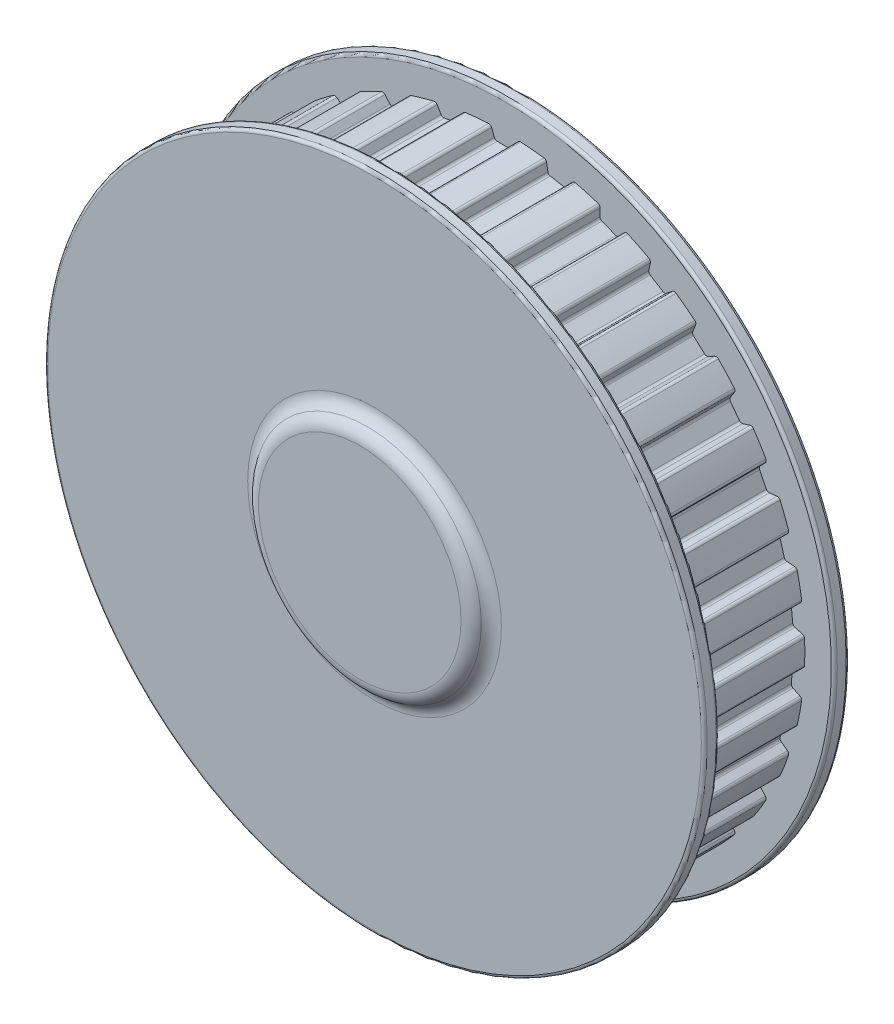
from build123d import *

# Parameters (mm, degrees)
BOSS_EXTRUDE1_DEPTH      = 7.25
BOSS_EXTRUDE1_DEPTH_BACK = 7.25
SKETCH7_R                = 50.756168406
CUT_EXTRUDE3_DEPTH       = 75.002549027
CUT_EXTRUDE3_DEPTH_BACK  = 75.002549027
SKETCH15_R               = 8.008120878
SKETCH15_R_2             = 2.25
BOSS_EXTRUDE2_DEPTH      = 5.5
SKETCH16_R               = 5
CUT_EXTRUDE4_DEPTH       = 3
BOSS_EXTRUDE3_START      = 7.5
SKETCH17_R               = 50.756168406
SKETCH17_R_2             = 5
BOSS_EXTRUDE3_DEPTH      = 7.5
CUT_EXTRUDE2_DEPTH       = 75.002549027
CUT_EXTRUDE2_DEPTH_BACK  = 75.002549027
FILLET2_R                = 0.51
BOSS_EXTRUDE4_START      = 2.5
SKETCH18_R               = 55.756168406
SKETCH18_R_2             = 50.756168406
SKETCH18_R_3             = 5
BOSS_EXTRUDE4_DEPTH      = 2.5
BOSS_EXTRUDE5_START      = -2.5
SKETCH19_R               = 55.756168406
SKETCH19_R_2             = 19
BOSS_EXTRUDE5_DEPTH      = 2.5
CUT_EXTRUDE5_DEPTH       = 87.371656987
FILLET3_R                = 0.5
CUT_EXTRUDE6_DEPTH       = 81.879543979
CUT_EXTRUDE6_DEPTH_BACK  = 81.879543979
SKETCH21_R               = 12.5
SKETCH22_R               = 18.951921224
CUT_EXTRUDE7_DEPTH       = 83.569671373
SKETCH22_2_R             = 18.951921224
BOSS_EXTRUDE6_DEPTH      = 2.5
FILLET4_R                = 2.5
FILLET5_R                = 2.5


with BuildPart() as part:
    # Sketch7 → Boss-Extrude1 (new, two sides: drawn at the far end of the back side and taken through both)
    with BuildSketch(Plane.XY.offset(-BOSS_EXTRUDE1_DEPTH_BACK)):
        Circle(SKETCH7_R)
    extrude(amount=BOSS_EXTRUDE1_DEPTH + BOSS_EXTRUDE1_DEPTH_BACK)

    # Sketch14 → Revolve1 (revolve)
    with BuildSketch(Plane(origin=(0, 0, 0), x_dir=(0, 0, -1), z_dir=(1, 0, 0)), mode=Mode.PRIVATE) as revolve1_sk:
        Polygon((-18, 6.739517467), (-18, 0), (0, 0), (0, 19), (-3.355534752, 19), (-11.020158508, 12.583105693), align=None)
        with BuildLine():
            ThreePointArc((-7.25, 19), (-8.580081567, 15.465471544), (-11.020158508, 12.583105693))
            Line((-11.020158508, 12.583105693), (-3.355534752, 19))
            Line((-3.355534752, 19), (-7.25, 19))
        make_face()
        with BuildLine():
            Line((-18, 10), (-18, 6.739517467))
            Line((-18, 6.739517467), (-11.020158508, 12.583105693))
            ThreePointArc((-11.020158508, 12.583105693), (-14.286666254, 10.687865845), (-18, 10))
        make_face()
    revolve(revolve1_sk.sketch.rotate(Axis((0, 0, -36.129595921), (0, 0, 1)), 270), axis=Axis((0, 0, -36.129595921), (0, 0, 1)))

    # Sketch10 → Cut-Extrude3 (cut, two sides: drawn at the far end of the back side and taken through both)
    with BuildSketch(Plane.XY.offset(-CUT_EXTRUDE3_DEPTH_BACK)):
        with BuildLine():
            Line((2.2, 7.7), (-2.2, 7.7))
            Line((-2.2, 7.7), (-2.2, 5.796550698))
            ThreePointArc((-2.2, 5.796550698), (0, 6.2), (2.2, 5.796550698))
            Line((2.2, 5.796550698), (2.2, 7.7))
        make_face()
        with BuildLine():
            ThreePointArc((2.2, 5.796550698), (0, 6.2), (-2.2, 5.796550698))
            Line((-2.2, 5.796550698), (-2.2, 0))
            Line((-2.2, 0), (2.2, 0))
            Line((2.2, 0), (2.2, 5.796550698))
        make_face()
        with BuildLine():
            Line((-2.2, 0), (-2.2, 5.796550698))
            ThreePointArc((-2.2, 5.796550698), (-3.521363372, -5.102940329), (6.2, 0))
            ThreePointArc((6.2, 0), (5.102940329, 3.521363372), (2.2, 5.796550698))
            Line((2.2, 5.796550698), (2.2, 0))
            Line((2.2, 0), (-2.2, 0))
        make_face()
    extrude(amount=CUT_EXTRUDE3_DEPTH + CUT_EXTRUDE3_DEPTH_BACK, mode=Mode.SUBTRACT)

    # Sketch15 → Boss-Extrude2 (add)
    with BuildSketch(Plane(origin=(0, 0, -7.25), x_dir=(-1, 0, 0), z_dir=(0, 0, -1))):
        Circle(SKETCH15_R)
        Circle(SKETCH15_R_2, mode=Mode.SUBTRACT)
    extrude(amount=-BOSS_EXTRUDE2_DEPTH)

    # Sketch16 → Cut-Extrude4 (cut)
    with BuildSketch(Plane(origin=(0, 0, -7.25), x_dir=(-1, 0, 0), z_dir=(0, 0, -1))):
        Circle(SKETCH16_R)
    extrude(amount=-CUT_EXTRUDE4_DEPTH, mode=Mode.SUBTRACT)

    # Sketch17 → Boss-Extrude3 (add)
    with BuildSketch(Plane(origin=(0, 0, -7.25), x_dir=(-1, 0, 0), z_dir=(0, 0, -1)).offset(BOSS_EXTRUDE3_START)):
        with Locations(Location((0, 0, 0), (0, 0, 180))):
            Circle(SKETCH17_R)
        Circle(SKETCH17_R_2, mode=Mode.SUBTRACT)
    extrude(amount=-BOSS_EXTRUDE3_DEPTH)

    # Sketch8 → Cut-Extrude2 (cut, two sides: drawn at the far end of the back side and taken through both)
    with BuildSketch(Plane.XY.offset(-CUT_EXTRUDE2_DEPTH_BACK)):
        Polygon((-1.629816853, 48.792889526), (-2.344391927, 50.756168406), (2.344391927, 50.756168406), (1.629816853, 48.792889526), align=None)
        Polygon((7.3636038, 48.261575921), (7.021947272, 50.322729072), (11.63089567, 49.4611673), (10.567736047, 47.662619799), align=None)
        Polygon((16.106265756, 46.086772231), (16.149162478, 48.175609555), (20.521323211, 46.481825464), (19.145783664, 44.90925672), align=None)
        Polygon((24.30044815, 42.342538787), (24.726437325, 44.387927435), (28.712921702, 41.91960081), (27.071844582, 40.626562766), align=None)
        Polygon((31.667107927, 37.15638097), (32.461683004, 39.088667684), (35.926736083, 35.929854428), (34.076006302, 34.960379943), align=None)
        Polygon((37.955382324, 30.704907163), (39.091485003, 32.458290236), (41.917108555, 28.716559947), (39.919750497, 28.103663312), align=None)
        Polygon((42.951131699, 23.207814569), (44.390073364, 24.722584644), (46.48004417, 20.525357458), (44.404075467, 20.289910133), align=None)
        Polygon((46.484231797, 14.920407684), (48.177011018, 16.144981083), (49.460157627, 11.635188538), (47.376272904, 11.785208399), align=None)
        Polygon((48.434367134, 6.124904211), (50.323338343, 7.017579555), (50.755964737, 2.348797228), (48.735128188, 2.879175529), align=None)
        Polygon((48.735128188, -2.879175529), (50.755964737, -2.348797228), (50.323338343, -7.017579555), (48.434367134, -6.124904211), align=None)
        Polygon((47.376272904, -11.785208399), (49.460157627, -11.635188538), (48.177011018, -16.144981083), (46.484231797, -14.920407684), align=None)
        Polygon((44.404075467, -20.289910133), (46.48004417, -20.525357458), (44.390073364, -24.722584644), (42.951131699, -23.207814569), align=None)
        Polygon((39.919750497, -28.103663312), (41.917108555, -28.716559947), (39.091485003, -32.458290236), (37.955382324, -30.704907163), align=None)
        Polygon((34.076006302, -34.960379943), (35.926736083, -35.929854428), (32.461683004, -39.088667684), (31.667107927, -37.15638097), align=None)
        Polygon((27.071844582, -40.626562766), (28.712921702, -41.91960081), (24.726437325, -44.387927435), (24.30044815, -42.342538787), align=None)
        Polygon((19.145783664, -44.90925672), (20.521323211, -46.481825464), (16.149162478, -48.175609555), (16.106265756, -46.086772231), align=None)
        Polygon((10.567736047, -47.662619799), (11.63089567, -49.4611673), (7.021947272, -50.322729072), (7.3636038, -48.261575921), align=None)
        Polygon((1.629816853, -48.792889526), (2.344391927, -50.756168406), (-2.344391927, -50.756168406), (-1.629816853, -48.792889526), align=None)
        Polygon((-7.3636038, -48.261575921), (-7.021947272, -50.322729072), (-11.63089567, -49.4611673), (-10.567736047, -47.662619799), align=None)
        Polygon((-16.106265756, -46.086772231), (-16.149162478, -48.175609555), (-20.521323211, -46.481825464), (-19.145783664, -44.90925672), align=None)
        Polygon((-24.30044815, -42.342538787), (-24.726437325, -44.387927435), (-28.712921702, -41.91960081), (-27.071844582, -40.626562766), align=None)
        Polygon((-31.667107927, -37.15638097), (-32.461683004, -39.088667684), (-35.926736083, -35.929854428), (-34.076006302, -34.960379943), align=None)
        Polygon((-37.955382324, -30.704907163), (-39.091485003, -32.458290236), (-41.917108555, -28.716559947), (-39.919750497, -28.103663312), align=None)
        Polygon((-42.951131699, -23.207814569), (-44.390073364, -24.722584644), (-46.48004417, -20.525357458), (-44.404075467, -20.289910133), align=None)
        Polygon((-46.484231797, -14.920407684), (-48.177011018, -16.144981083), (-49.460157627, -11.635188538), (-47.376272904, -11.785208399), align=None)
        Polygon((-48.434367134, -6.124904211), (-50.323338343, -7.017579555), (-50.755964737, -2.348797228), (-48.735128188, -2.879175529), align=None)
        Polygon((-48.735128188, 2.879175529), (-50.755964737, 2.348797228), (-50.323338343, 7.017579555), (-48.434367134, 6.124904211), align=None)
        Polygon((-47.376272904, 11.785208399), (-49.460157627, 11.635188538), (-48.177011018, 16.144981083), (-46.484231797, 14.920407684), align=None)
        Polygon((-44.404075467, 20.289910133), (-46.48004417, 20.525357458), (-44.390073364, 24.722584644), (-42.951131699, 23.207814569), align=None)
        Polygon((-39.919750497, 28.103663312), (-41.917108555, 28.716559947), (-39.091485003, 32.458290236), (-37.955382324, 30.704907163), align=None)
        Polygon((-34.076006302, 34.960379943), (-35.926736083, 35.929854428), (-32.461683004, 39.088667684), (-31.667107927, 37.15638097), align=None)
        Polygon((-27.071844582, 40.626562766), (-28.712921702, 41.91960081), (-24.726437325, 44.387927435), (-24.30044815, 42.342538787), align=None)
        Polygon((-19.145783664, 44.90925672), (-20.521323211, 46.481825464), (-16.149162478, 48.175609555), (-16.106265756, 46.086772231), align=None)
        Polygon((-10.567736047, 47.662619799), (-11.63089567, 49.4611673), (-7.021947272, 50.322729072), (-7.3636038, 48.261575921), align=None)
    extrude(amount=CUT_EXTRUDE2_DEPTH + CUT_EXTRUDE2_DEPTH_BACK, mode=Mode.SUBTRACT)

    # Fillet2
    fillet2_edges = [part.edges().sort_by_distance(p)[0] for p in [
        (28.668386638, -41.884510727, -3.75),
        (24.714876957, -44.332420285, -3.75),
        (24.30044815, -42.342538787, -3.75),
        (27.071844582, -40.626562766, -3.75),
        (35.876511526, -35.903545117, -3.75),
        (32.440120061, -39.03622986, -3.75),
        (31.667107927, -37.15638097, -3.75),
        (34.076006302, -34.960379943, -3.75),
        (41.862904844, -28.699927339, -3.75),
        (39.060653785, -32.410707446, -3.75),
        (37.955382324, -30.704907163, -3.75),
        (39.919750497, -28.103663312, -3.75),
        (46.423707146, -20.518967958, -3.75),
        (44.351023792, -24.681477263, -3.75),
        (42.951131699, -23.207814569, -3.75),
        (44.404075467, -20.289910133, -3.75),
        (49.403605781, -11.639259733, -3.75),
        (48.131072877, -16.111748973, -3.75),
        (46.484231797, -14.920407684, -3.75),
        (47.376272904, -11.785208399, -3.75),
        (50.701123874, -2.363190477, -3.75),
        (50.272076002, -6.993354396, -3.75),
        (48.434367134, -6.124904211, -3.75),
        (48.735128188, -2.879175529, -3.75),
        (50.272076002, 6.993354396, -3.75),
        (50.701123874, 2.363190477, -3.75),
        (48.735128188, 2.879175529, -3.75),
        (48.434367134, 6.124904211, -3.75),
        (48.131072877, 16.111748973, -3.75),
        (49.403605781, 11.639259733, -3.75),
        (47.376272904, 11.785208399, -3.75),
        (46.484231797, 14.920407684, -3.75),
        (44.351023792, 24.681477263, -3.75),
        (46.423707146, 20.518967958, -3.75),
        (44.404075467, 20.289910133, -3.75),
        (42.951131699, 23.207814569, -3.75),
        (39.060653785, 32.410707446, -3.75),
        (41.862904844, 28.699927339, -3.75),
        (39.919750497, 28.103663312, -3.75),
        (37.955382324, 30.704907163, -3.75),
        (32.440120061, 39.03622986, -3.75),
        (35.876511526, 35.903545117, -3.75),
        (34.076006302, 34.960379943, -3.75),
        (31.667107927, 37.15638097, -3.75),
        (24.714876957, 44.332420285, -3.75),
        (28.668386638, 41.884510727, -3.75),
        (27.071844582, 40.626562766, -3.75),
        (24.30044815, 42.342538787, -3.75),
        (16.147998359, 48.118923307, -3.75),
        (20.483994226, 46.43914956, -3.75),
        (19.145783664, 44.90925672, -3.75),
        (16.106265756, 46.086772231, -3.75),
        (7.031219046, 50.266794109, -3.75),
        (11.602043959, 49.412358851, -3.75),
        (10.567736047, 47.662619799, -3.75),
        (7.3636038, 48.261575921, -3.75),
        (11.602043959, -49.412358851, -3.75),
        (7.031219046, -50.266794109, -3.75),
        (7.3636038, -48.261575921, -3.75),
        (10.567736047, -47.662619799, -3.75),
        (20.483994226, -46.43914956, -3.75),
        (16.147998359, -48.118923307, -3.75),
        (16.106265756, -46.086772231, -3.75),
        (19.145783664, -44.90925672, -3.75),
        (2.325, -50.702889526, -3.75),
        (-2.325, -50.702889526, -3.75),
        (-1.629816853, -48.792889526, -3.75),
        (1.629816853, -48.792889526, -3.75),
        (-7.031219046, -50.266794109, -3.75),
        (-11.602043959, -49.412358851, -3.75),
        (-10.567736047, -47.662619799, -3.75),
        (-7.3636038, -48.261575921, -3.75),
        (-16.147998359, -48.118923307, -3.75),
        (-20.483994226, -46.43914956, -3.75),
        (-19.145783664, -44.90925672, -3.75),
        (-16.106265756, -46.086772231, -3.75),
        (-24.714876957, -44.332420285, -3.75),
        (-28.668386638, -41.884510727, -3.75),
        (-27.071844582, -40.626562766, -3.75),
        (-24.30044815, -42.342538787, -3.75),
        (-32.440120061, -39.03622986, -3.75),
        (-35.876511526, -35.903545117, -3.75),
        (-34.076006302, -34.960379943, -3.75),
        (-31.667107927, -37.15638097, -3.75),
        (-39.060653785, -32.410707446, -3.75),
        (-41.862904844, -28.699927339, -3.75),
        (-39.919750497, -28.103663312, -3.75),
        (-37.955382324, -30.704907163, -3.75),
        (-44.351023792, -24.681477263, -3.75),
        (-46.423707146, -20.518967958, -3.75),
        (-44.404075467, -20.289910133, -3.75),
        (-42.951131699, -23.207814569, -3.75),
        (-48.131072877, -16.111748973, -3.75),
        (-49.403605781, -11.639259733, -3.75),
        (-47.376272904, -11.785208399, -3.75),
        (-46.484231797, -14.920407684, -3.75),
        (-50.272076002, -6.993354396, -3.75),
        (-50.701123874, -2.363190477, -3.75),
        (-48.735128188, -2.879175529, -3.75),
        (-48.434367134, -6.124904211, -3.75),
        (-50.701123874, 2.363190477, -3.75),
        (-50.272076002, 6.993354396, -3.75),
        (-48.434367134, 6.124904211, -3.75),
        (-48.735128188, 2.879175529, -3.75),
        (-49.403605781, 11.639259733, -3.75),
        (-48.131072877, 16.111748973, -3.75),
        (-46.484231797, 14.920407684, -3.75),
        (-47.376272904, 11.785208399, -3.75),
        (-46.423707146, 20.518967958, -3.75),
        (-44.351023792, 24.681477263, -3.75),
        (-42.951131699, 23.207814569, -3.75),
        (-44.404075467, 20.289910133, -3.75),
        (-41.862904844, 28.699927339, -3.75),
        (-39.060653785, 32.410707446, -3.75),
        (-37.955382324, 30.704907163, -3.75),
        (-39.919750497, 28.103663312, -3.75),
        (-35.876511526, 35.903545117, -3.75),
        (-32.440120061, 39.03622986, -3.75),
        (-31.667107927, 37.15638097, -3.75),
        (-34.076006302, 34.960379943, -3.75),
        (-28.668386638, 41.884510727, -3.75),
        (-24.714876957, 44.332420285, -3.75),
        (-24.30044815, 42.342538787, -3.75),
        (-27.071844582, 40.626562766, -3.75),
        (-20.483994226, 46.43914956, -3.75),
        (-16.147998359, 48.118923307, -3.75),
        (-16.106265756, 46.086772231, -3.75),
        (-19.145783664, 44.90925672, -3.75),
        (-11.602043959, 49.412358851, -3.75),
        (-7.031219046, 50.266794109, -3.75),
        (-7.3636038, 48.261575921, -3.75),
        (-10.567736047, 47.662619799, -3.75),
        (-2.325, 50.702889526, -3.75),
        (2.325, 50.702889526, -3.75),
        (1.629816853, 48.792889526, -3.75),
        (-1.629816853, 48.792889526, -3.75),
    ]]
    fillet(fillet2_edges, radius=FILLET2_R)

    # Sketch18 → Boss-Extrude4 (add)
    # profile 1 of 2: a face of its own
    with BuildSketch(Plane(origin=(0, 0, -14.75), x_dir=(-1, 0, 0), z_dir=(0, 0, -1)).offset(BOSS_EXTRUDE4_START)):
        Circle(SKETCH18_R)
        Circle(SKETCH18_R_2, mode=Mode.SUBTRACT)
    # profile 2 of 2: a face of its own
    with BuildSketch(Plane(origin=(0, 0, -14.75), x_dir=(-1, 0, 0), z_dir=(0, 0, -1)).offset(BOSS_EXTRUDE4_START)):
        Circle(SKETCH18_R_2)
        Circle(SKETCH18_R_3, mode=Mode.SUBTRACT)
    extrude(amount=-BOSS_EXTRUDE4_DEPTH)

    # Sketch19 → Boss-Extrude5 (add)
    with BuildSketch(Plane.XY.offset(7.25).offset(BOSS_EXTRUDE5_START)):
        with Locations(Location((0, 0, 0), (0, 0, 180))):
            Circle(SKETCH19_R)
        Circle(SKETCH19_R_2, mode=Mode.SUBTRACT)
    extrude(amount=BOSS_EXTRUDE5_DEPTH)

    # Sketch20 → Cut-Extrude5 (cut, through all)
    with BuildSketch(Plane.XY.offset(18)):
        with BuildLine():
            Line((-2.2, 7.7), (-2.2, 5.796550698))
            ThreePointArc((-2.2, 5.796550698), (0, 6.2), (2.2, 5.796550698))
            Line((2.2, 5.796550698), (2.2, 7.7))
            Line((2.2, 7.7), (-2.2, 7.7))
        make_face()
        with BuildLine():
            ThreePointArc((2.2, 5.796550698), (0, 6.2), (-2.2, 5.796550698))
            ThreePointArc((-2.2, 5.796550698), (-3.521363372, -5.102940329), (6.2, 0))
            ThreePointArc((6.2, 0), (5.102940329, 3.521363372), (2.2, 5.796550698))
        make_face()
    extrude(amount=-CUT_EXTRUDE5_DEPTH, mode=Mode.SUBTRACT)

    # Fillet3
    fillet3_edges = [part.edges().sort_by_distance(p)[0] for p in [
        (55.756168406, 0, -14.75),
        (55.756168406, 0, -17.25),
        (0, 7.7, 18),
        (2.2, 6.748275349, 18),
        (-2.2, 6.748275349, 18),
        (0, -6.2, 18),
        (55.756168406, 0, 4.75),
        (55.756168406, 0, 7.25),
        (2.2, 5.796550698, 0.375),
        (-2.2, 5.796550698, 0.375),
        (-19, 0, 7.25),
        (-10, 0, 18),
    ]]
    fillet(fillet3_edges, radius=FILLET3_R)

    # Sketch21 → Cut-Extrude6 (cut, two sides: drawn at the far end of the back side and taken through both)
    with BuildSketch(Plane.XY.offset(-CUT_EXTRUDE6_DEPTH_BACK)):
        Circle(SKETCH21_R)
    extrude(amount=CUT_EXTRUDE6_DEPTH + CUT_EXTRUDE6_DEPTH_BACK, mode=Mode.SUBTRACT)

    # Sketch22 → Cut-Extrude7 (cut, through all)
    with BuildSketch(Plane.XY.offset(7.25)):
        Circle(SKETCH22_R)
    extrude(amount=CUT_EXTRUDE7_DEPTH, mode=Mode.SUBTRACT)

    # Sketch22<2> → Boss-Extrude6 (add)
    with BuildSketch(Plane.XY.offset(7.25)):
        Circle(SKETCH22_2_R)
    extrude(amount=BOSS_EXTRUDE6_DEPTH)

    # Fillet4
    fillet4_edges = [part.edges().sort_by_distance(p)[0] for p in [
        (-18.951921224, 0, 7.259288608),
    ]]
    fillet(fillet4_edges, radius=FILLET4_R - 0.0001)  # a hair under: the kernel refuses the full size

    # Fillet5
    fillet5_edges = [part.edges().sort_by_distance(p)[0] for p in [
        (-18.951921224, 0, 9.75),
    ]]
    fillet(fillet5_edges, radius=FILLET5_R)


solid = part.part
